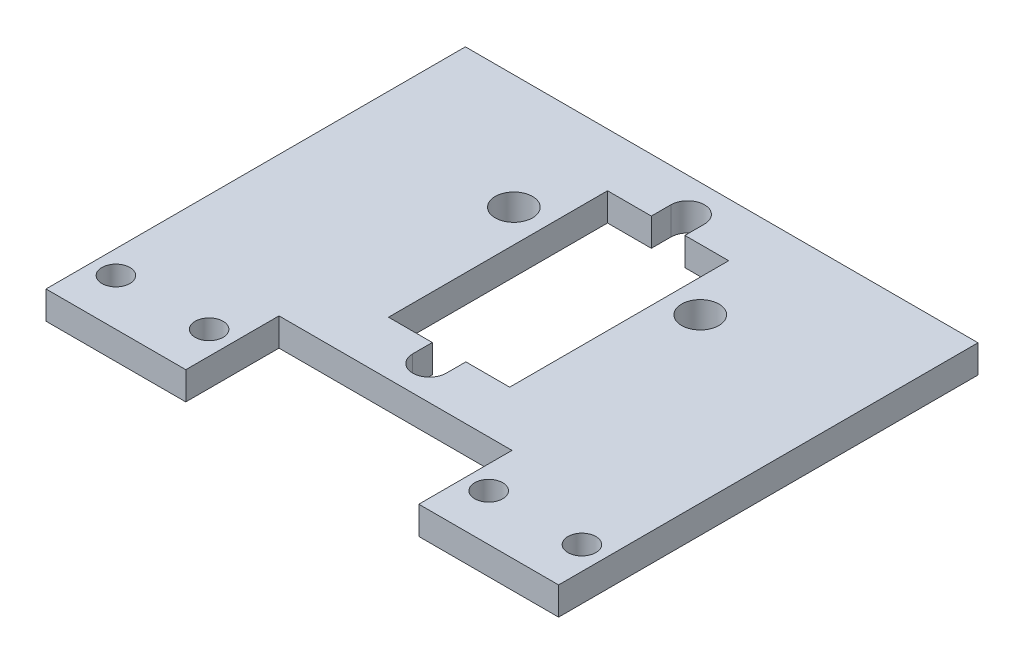
from build123d import *

# Parameters (mm, degrees)
SKETCH1_R            = 1.5
SKETCH1_R_2          = 1.1
SKETCH1_W            = 13
SKETCH1_H            = 23.5
BOSS_EXTRUDE1_DEPTH  = 3
SKETCH2_R            = 2
CUT_EXTRUDE1_DEPTH   = 72.126647608
M3_CLEARANCE_HOLE1_D = 3.6
CUT_EXTRUDE2_DEPTH   = 72.126647608


with BuildPart() as part:
    # Sketch1 → Boss-Extrude1 (new body)
    with BuildSketch(Plane(origin=(0, 0, 0), x_dir=(1, 0, 0), z_dir=(0, 1, 0))):
        Polygon((0, 0), (15, 0), (15, 10), (40, 10), (40, 0), (55, 0), (55, 45), (0, 45), align=None)
        with Locations((42.5, 5)):
            Circle(SKETCH1_R, mode=Mode.SUBTRACT)
        with Locations((52.5, 5)):
            Circle(SKETCH1_R, mode=Mode.SUBTRACT)
        with Locations((12.5, 5)):
            Circle(SKETCH1_R, mode=Mode.SUBTRACT)
        with Locations((2.5, 5)):
            Circle(SKETCH1_R, mode=Mode.SUBTRACT)
        with Locations((27.5, 41.35)):
            Circle(SKETCH1_R_2, mode=Mode.SUBTRACT)
        with Locations((27.5, 13.65)):
            Circle(SKETCH1_R_2, mode=Mode.SUBTRACT)
        with Locations((27.5, 27.5)):
            Rectangle(SKETCH1_W, SKETCH1_H, mode=Mode.SUBTRACT)
    extrude(amount=BOSS_EXTRUDE1_DEPTH)

    # Sketch2 → Cut-Extrude1 (cut, through all)
    with BuildSketch(Plane(origin=(0, 3, 0), x_dir=(1, 0, 0), z_dir=(0, 1, 0))):
        with Locations((17.5, 32.699969783)):
            Circle(SKETCH2_R)
        with Locations((37.5, 32.699969783)):
            Circle(SKETCH2_R)
    extrude(amount=-CUT_EXTRUDE1_DEPTH, mode=Mode.SUBTRACT)

    # M3 Clearance Hole1 (through all)
    with Locations(Plane(origin=(0, 3, 0), x_dir=(1, 0, 0), z_dir=(0, 1, 0))):
        with Locations((27.5, 13.65), (27.5, 41.35)):
            Hole(M3_CLEARANCE_HOLE1_D / 2)

    # Sketch5 → Cut-Extrude2 (cut, through all)
    with BuildSketch(Plane(origin=(0, 3, 0), x_dir=(1, 0, 0), z_dir=(0, 1, 0))):
        with BuildLine():
            Line((29.3, 15.75), (25.7, 15.75))
            Line((25.7, 15.75), (25.7, 13.65))
            ThreePointArc((25.7, 13.65), (27.5, 15.45), (29.3, 13.65))
            Line((29.3, 13.65), (29.3, 15.75))
        make_face()
        with BuildLine():
            Line((25.7, 39.25), (29.3, 39.25))
            Line((29.3, 39.25), (29.3, 41.35))
            ThreePointArc((29.3, 41.35), (27.5, 39.55), (25.7, 41.35))
            Line((25.7, 41.35), (25.7, 39.25))
        make_face()
    extrude(amount=-CUT_EXTRUDE2_DEPTH, mode=Mode.SUBTRACT)


solid = part.part
